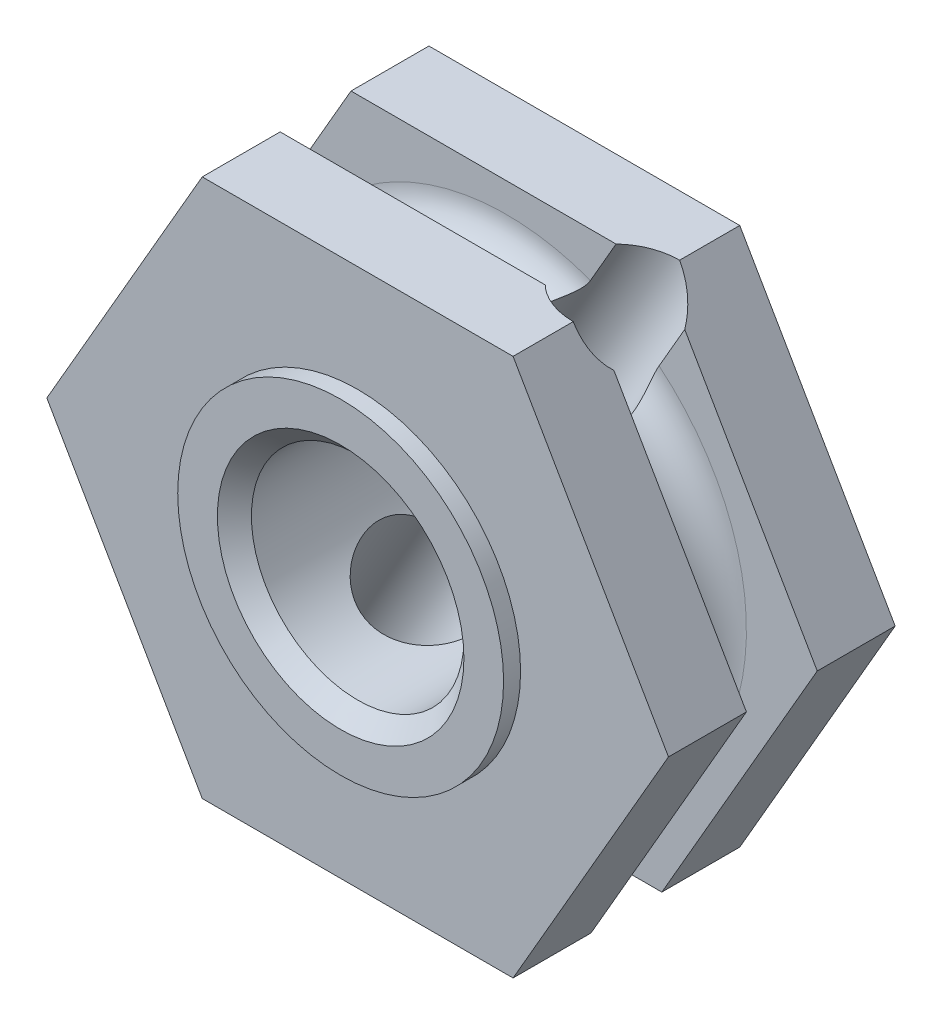
from build123d import *

# Parameters (mm, degrees)
BOSS_EXTRUDE1_DEPTH = 2.54
SKETCH2_R           = 3.65125
SKETCH2_R_2         = 2.38125
BOSS_EXTRUDE2_DEPTH = 0.381
SKETCH3_R           = 2.38125
CUT_EXTRUDE1_DEPTH  = 11.522303198
CHAMFER1_SIZE       = 0.381
SKETCH4_R           = 1.19126
CUT_EXTRUDE2_DEPTH  = 17.225585806


with BuildPart() as part:
    # Sketch1 → Boss-Extrude1 (new, symmetric)
    with BuildSketch(Plane.XY):
        Polygon((3.482865499, 6.0325), (-3.482865499, 6.0325), (-6.965730998, 0), (-3.482865499, -6.0325), (3.482865499, -6.0325), (6.965730998, 0), align=None)
    extrude(amount=BOSS_EXTRUDE1_DEPTH, both=True)

    # Sketch2 → Boss-Extrude2 (add)
    with BuildSketch(Plane.XY.offset(2.54)):
        with Locations(Location((0, 0, 0), (0, 0, 180))):
            Circle(SKETCH2_R)
        with Locations(Location((0, 0, 0), (0, 0, 180))):
            Circle(SKETCH2_R_2, mode=Mode.SUBTRACT)
    extrude(amount=BOSS_EXTRUDE2_DEPTH)

    # Sketch3 → Cut-Extrude1 (cut, through all)
    with BuildSketch(Plane.XY.offset(2.54)):
        with Locations(Location((0, 0, 0), (0, 0, 180))):
            Circle(SKETCH3_R)
    extrude(amount=-CUT_EXTRUDE1_DEPTH, mode=Mode.SUBTRACT)

    # Chamfer1
    chamfer1_edges = [part.edges().sort_by_distance(p)[0] for p in [
        (2.38125, 0, 2.921),
    ]]
    chamfer(chamfer1_edges, length=CHAMFER1_SIZE - 0.0001)  # a hair under: the kernel refuses the full size

    # Sketch4 → Cut-Extrude2 (cut, through all)
    with BuildSketch(Plane(origin=(3.482865499, 6.0325, 0), x_dir=(0, 0, -1), z_dir=(-0.49999999999999944, -0.8660254037844389, 0))):
        with Locations(Location((0, 0, 0), (0, 0, 270))):
            Circle(SKETCH4_R)
    extrude(amount=CUT_EXTRUDE2_DEPTH, mode=Mode.SUBTRACT)

    # Sketch5 → Cut-Revolve1 (revolve, cut)
    with BuildSketch(Plane(origin=(0, 0, 0), x_dir=(0, 0, 1), z_dir=(-0.8660254037844389, 0.4999999999999995, 0)), mode=Mode.PRIVATE) as cut_revolve1_sk:
        with BuildLine():
            Line((-0.79375, 6.965730998), (-0.79375, 5.378230998))
            ThreePointArc((-0.79375, 5.378230998), (0, 4.584480998), (0.79375, 5.378230998))
            Line((0.79375, 5.378230998), (0.79375, 6.965730998))
            Line((0.79375, 6.965730998), (-0.79375, 6.965730998))
        make_face()
    revolve(cut_revolve1_sk.sketch.rotate(Axis((0, 0, -1000.088934232), (0, 0, 1)), 300), axis=Axis((0, 0, -1000.088934232), (0, 0, 1)), mode=Mode.SUBTRACT)


solid = part.part
